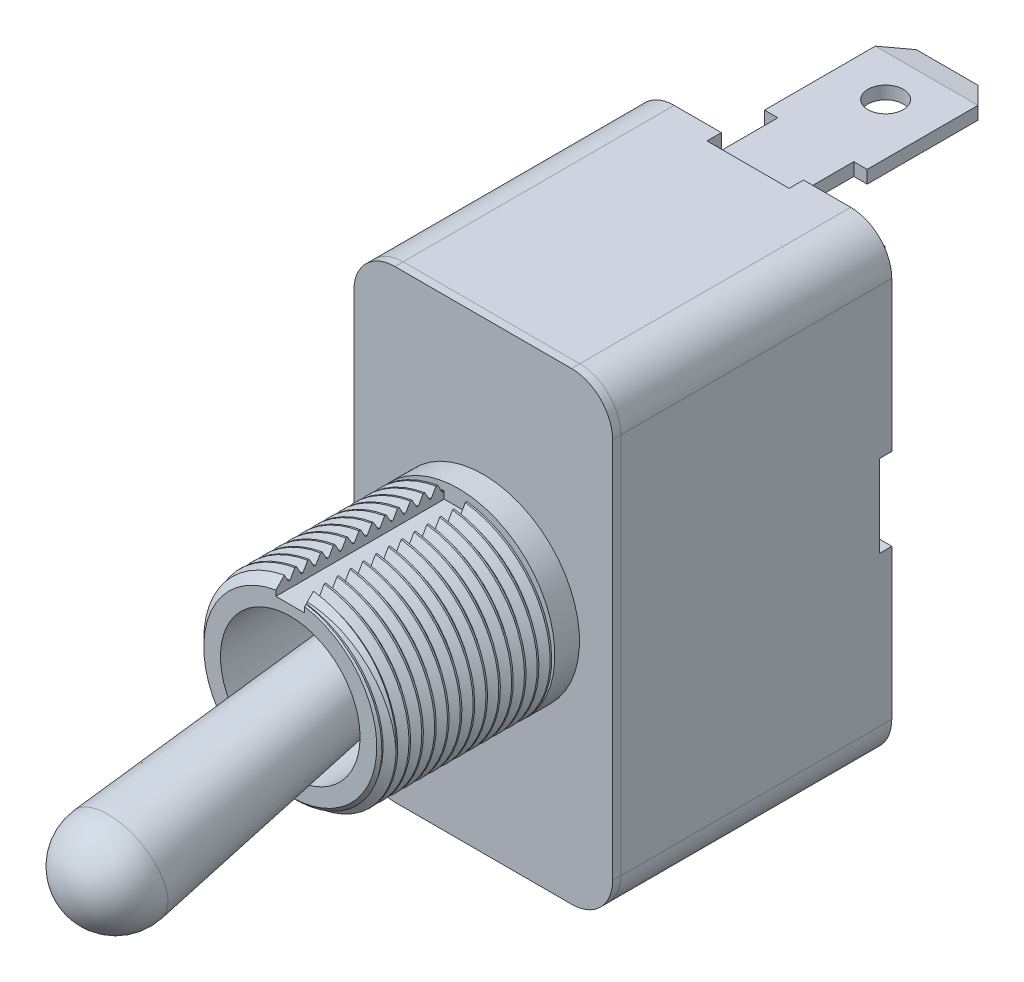
from build123d import *
from OCP.BRepFilletAPI import BRepFilletAPI_MakeChamfer

# Parameters (mm, degrees)
SKETCH4_R             = 5.953125
BOSS_EXTRUDE1_DEPTH   = 10.414
CUT_SWEEP1_PITCH      = 0.79375
SKETCH7_OUTSIDE_W     = 38.694
SKETCH7_OUTSIDE_H     = 38.694
SKETCH7_OUTSIDE_R     = 5.351643294
CUT_EXTRUDE1_DEPTH    = 10.414
CUT_EXTRUDE1_DRAFT    = -45
SKETCH8_R             = 5.953125
BOSS_EXTRUDE2_DEPTH   = 1.524
BOSS_EXTRUDE3_DEPTH   = 0.508
SKETCH10_R            = 4.318
CUT_EXTRUDE2_DEPTH    = 11.938
CUT_EXTRUDE3_DEPTH    = 10.414
BOSS_EXTRUDE4_DEPTH   = 16.764
SKETCH14_W            = 8.382
SKETCH14_H            = 5.08
CUT_EXTRUDE4_DEPTH    = 0.889
SKETCH15_W            = 5.08
SKETCH15_H            = 16.002
CUT_EXTRUDE5_DEPTH    = 0.762
SKETCH16_W            = 6.35
SKETCH16_H            = 4.699
BOSS_EXTRUDE5_DEPTH   = 0.79375
SKETCH17_R            = 1.0922
BOSS_EXTRUDE6_DEPTH   = 0.79375
CHAMFER1_SIZE         = 1.27
CHAMFER2_SIZE         = 1.27
CHAMFER2_SIZE2        = 0.1905
SKETCH18_W            = 4.699
SKETCH18_H            = 6.35
BOSS_EXTRUDE7_DEPTH   = 0.79375
SKETCH19_R            = 1.0922
BOSS_EXTRUDE8_DEPTH   = 0.79375
CHAMFER3_SIZE         = 1.27
CHAMFER4_SIZE         = 0.1905
CHAMFER4_SIZE2        = 1.27
BOSS_EXTRUDE9_START   = -6.35
SKETCH20_R            = 5.437569252
BOSS_EXTRUDE9_DEPTH   = 2.032
BODY_MOVE_COPY1_ANGLE = 120
BODY_MOVE_COPY2_ANGLE = 11.5


with BuildPart() as part:
    # Sketch4 → Boss-Extrude1 (new body)
    with BuildSketch(Plane(origin=(0, 11.938, 0), x_dir=(-1, 0, 0), z_dir=(0, 1, 0))):
        with Locations(Location((0, 0, 0), (0, 0, 90))):
            Circle(SKETCH4_R)
    extrude(amount=-BOSS_EXTRUDE1_DEPTH)

    # Cut-Sweep1: arcs per turn and ends read off the stored shape
    # Cut-Sweep1: the profile of Sketch6 screwed along a right-hand helix through 15.12 turns, 8 arcs to a turn; built about Z, then put on its axis
    cut_sweep1_z = Axis((0, 0, 0), (0, 0, 1))
    cut_sweep1_corners = [(5.437569252, 0, -1.190625), (5.437569252, 0, -1.09140625), (5.996087979, 0, -0.768945313), (5.996087979, 0, -1.513085938)]
    with BuildLine(mode=Mode.PRIVATE) as cut_sweep1_profile:
        Line(cut_sweep1_corners[0], cut_sweep1_corners[1])
        Line(cut_sweep1_corners[1], cut_sweep1_corners[2])
        Line(cut_sweep1_corners[2], cut_sweep1_corners[3])
        Line(cut_sweep1_corners[3], cut_sweep1_corners[0])
    cut_sweep1_cap = Face(cut_sweep1_profile.wire())
    cut_sweep1_turn_angles = [0, 22.5, 45, 67.5, 90, 112.5, 135, 157.5, 180, 202.5, 225, 247.5, 270, 292.5, 315, 337.5, 360]
    cut_sweep1_turn_weights = [1, 0.9238795325112867, 1, 0.9238795325112867, 1, 0.9238795325112867, 1, 0.9238795325112867, 1, 0.9238795325112867, 1, 0.9238795325112867, 1, 0.9238795325112867, 1, 0.9238795325112867, 1]
    cut_sweep1_turn_rails = [Edge.make_bspline([Vector(p[0], p[1], 0).rotate(cut_sweep1_z, cut_sweep1_turn_angles[k]) / cut_sweep1_turn_weights[k] + Vector(0, 0, p[2] + CUT_SWEEP1_PITCH * cut_sweep1_turn_angles[k] / 360) for k in range(17)], [0, 0, 0, 1, 1, 2, 2, 3, 3, 4, 4, 5, 5, 6, 6, 7, 7, 8, 8, 8], 2, cut_sweep1_turn_weights) for p in cut_sweep1_corners]
    cut_sweep1_turn_sides = [Face.make_surface_from_curves(cut_sweep1_turn_rails[p[0]], cut_sweep1_turn_rails[p[1]]) for p in [(0, 1), (1, 2), (2, 3), (3, 0)]]
    cut_sweep1_last_angles = [5400, 5421.6, 5443.2]
    cut_sweep1_last_weights = [1, 0.929776485888252, 1]
    cut_sweep1_last_rails = [Edge.make_bspline([Vector(p[0], p[1], 0).rotate(cut_sweep1_z, cut_sweep1_last_angles[k]) / cut_sweep1_last_weights[k] + Vector(0, 0, p[2] + CUT_SWEEP1_PITCH * cut_sweep1_last_angles[k] / 360) for k in range(3)], [0, 0, 0, 1, 1, 1], 2, cut_sweep1_last_weights) for p in cut_sweep1_corners]
    cut_sweep1_last_sides = [Face.make_surface_from_curves(cut_sweep1_last_rails[p[0]], cut_sweep1_last_rails[p[1]]) for p in [(0, 1), (1, 2), (2, 3), (3, 0)]]
    cut_sweep1 = Plane(origin=(0, 11.938, 0), x_dir=(-1, 0, 0), z_dir=(0, -1, 0)) * Solid(Shell([*[p.moved(Location((0, 0, CUT_SWEEP1_PITCH * i))) for i in range(15) for p in cut_sweep1_turn_sides], *cut_sweep1_last_sides, cut_sweep1_cap, cut_sweep1_cap.rotate(cut_sweep1_z, 5443.2).moved(Location((0, 0, CUT_SWEEP1_PITCH * 5443.2 / 360)))]))
    add(cut_sweep1, mode=Mode.SUBTRACT)


with BuildPart() as cut_extrude1_tool:
    # Sketch7 outside → Cut-Extrude1 (with draft: the straight prism first)
    with BuildSketch(Plane(origin=(0, 11.938, 0), x_dir=(1, 0, 0), z_dir=(0, 1, 0))):
        Rectangle(SKETCH7_OUTSIDE_W, SKETCH7_OUTSIDE_H)
        Circle(SKETCH7_OUTSIDE_R, mode=Mode.SUBTRACT)
    extrude(amount=-CUT_EXTRUDE1_DEPTH)
    # Cut-Extrude1: the draft: its side faces are tilted about the plane it starts from
    cut_extrude1_sides = [cut_extrude1_tool.faces().sort_by_distance(p)[0] for p in [
        (0, 6.731, 19.347),
        (19.347, 6.731, 0),
        (0, 6.731, -19.347),
        (-19.347, 6.731, 0),
        (-5.351643294, 6.731, 0),
    ]]
    draft(cut_extrude1_sides, Plane(origin=(0, 11.938, 0), x_dir=(1, 0, 0), z_dir=(0, 1, 0)), CUT_EXTRUDE1_DRAFT)


with BuildPart() as part_1:
    add(part.part)

    # Cut-Extrude1: cut by cut_extrude1_tool
    add(cut_extrude1_tool.part, mode=Mode.SUBTRACT)

    # Sketch8 → Boss-Extrude2 (add)
    with BuildSketch(Plane.XZ.offset(-1.524)):
        with Locations(Location((0, 0, 0), (0, 0, 92.921710335))):
            Circle(SKETCH8_R)
    extrude(amount=BOSS_EXTRUDE2_DEPTH)

    # Sketch9 → Boss-Extrude3 (add)
    with BuildSketch(Plane.XZ):
        with BuildLine():
            Line((11.811, 8.001), (-11.811, 8.001))
            ThreePointArc((-11.811, 8.001), (-13.607051224, 7.257051224), (-14.351, 5.461))
            Line((-14.351, 5.461), (-14.351, -5.461))
            ThreePointArc((-14.351, -5.461), (-13.607051224, -7.257051224), (-11.811, -8.001))
            Line((-11.811, -8.001), (11.811, -8.001))
            ThreePointArc((11.811, -8.001), (13.607051224, -7.257051224), (14.351, -5.461))
            Line((14.351, -5.461), (14.351, 5.461))
            ThreePointArc((14.351, 5.461), (13.607051224, 7.257051224), (11.811, 8.001))
        make_face()
    extrude(amount=BOSS_EXTRUDE3_DEPTH)

    # Sketch10 → Cut-Extrude2 (cut)
    with BuildSketch(Plane(origin=(0, 11.938, 0), x_dir=(1, 0, 0), z_dir=(0, 1, 0))):
        with Locations(Location((0, 0, 0), (0, 0, 270))):
            Circle(SKETCH10_R)
    extrude(amount=-CUT_EXTRUDE2_DEPTH, mode=Mode.SUBTRACT)

    # Sketch11 → Cut-Extrude3 (cut)
    with BuildSketch(Plane(origin=(0, 11.938, 0), x_dir=(1, 0, 0), z_dir=(0, 1, 0))):
        with BuildLine():
            Line((4.937125, 0.889), (4.937125, -0.889))
            Line((4.937125, -0.889), (5.88637208, -0.889))
            ThreePointArc((5.88637208, -0.889), (5.953125, 0), (5.88637208, 0.889))
            Line((5.88637208, 0.889), (4.937125, 0.889))
        make_face()
    extrude(amount=-CUT_EXTRUDE3_DEPTH, mode=Mode.SUBTRACT)


with BuildPart() as body_2:
    # Sketch12 → Revolve1 (revolve)
    with BuildSketch(Plane.XY, mode=Mode.PRIVATE) as revolve1_sk:
        with BuildLine():
            Line((0, 4.826), (-2.214699358, 4.826))
            Line((-2.214699358, 4.826), (-3.044816605, 22.974731047))
            ThreePointArc((-3.044816605, 22.974731047), (-2.203950518, 25.219446773), (0, 26.162))
            Line((0, 26.162), (0, 4.826))
        make_face()
    revolve(revolve1_sk.sketch.rotate(Axis((0, 0, 0), (0, 1, 0)), 270), axis=Axis((0, 0, 0), (0, 1, 0)))


with BuildPart() as body_3:
    # Sketch13 → Boss-Extrude4 (new body)
    with BuildSketch(Plane.XZ.offset(0.508)):
        with BuildLine():
            Line((11.811, 8.001), (-11.811, 8.001))
            ThreePointArc((-11.811, 8.001), (-13.607051224, 7.257051224), (-14.351, 5.461))
            Line((-14.351, 5.461), (-14.351, -5.461))
            ThreePointArc((-14.351, -5.461), (-13.607051224, -7.257051224), (-11.811, -8.001))
            Line((-11.811, -8.001), (11.811, -8.001))
            ThreePointArc((11.811, -8.001), (13.607051224, -7.257051224), (14.351, -5.461))
            Line((14.351, -5.461), (14.351, 5.461))
            ThreePointArc((14.351, 5.461), (13.607051224, 7.257051224), (11.811, 8.001))
        make_face()
    extrude(amount=BOSS_EXTRUDE4_DEPTH)

    # Sketch14 → Cut-Extrude4 (cut)
    with BuildSketch(Plane.XZ.offset(17.272)):
        with Locations((-10.16, 0)):
            Rectangle(SKETCH14_W, SKETCH14_H)
        with Locations((10.16, 0)):
            Rectangle(SKETCH14_W, SKETCH14_H)
    extrude(amount=-CUT_EXTRUDE4_DEPTH, mode=Mode.SUBTRACT)

    # Sketch15 → Cut-Extrude5 (cut)
    with BuildSketch(Plane.XZ.offset(17.272)):
        Rectangle(SKETCH15_W, SKETCH15_H)
    extrude(amount=-CUT_EXTRUDE5_DEPTH, mode=Mode.SUBTRACT)


with BuildPart() as body_4:
    # Sketch16 → Boss-Extrude5 (new body)
    with BuildSketch(Plane.XZ.offset(16.383)):
        with Locations((10.414, 0)):
            Rectangle(SKETCH16_W, SKETCH16_H)
    extrude(amount=BOSS_EXTRUDE5_DEPTH)

    # Sketch17 → Boss-Extrude6 (add)
    with BuildSketch(Plane.ZY.offset(-13.589)):
        Polygon((-3.175, -28.702), (3.175, -28.702), (3.175, -20.574), (2.3495, -20.574), (2.3495, -16.383), (-2.3495, -16.383), (-2.3495, -20.574), (-3.175, -20.574), align=None)
        with Locations((0, -24.892)):
            Circle(SKETCH17_R, mode=Mode.SUBTRACT)
    extrude(amount=BOSS_EXTRUDE6_DEPTH)

    # Chamfer1
    chamfer1_edges = [body_4.edges().sort_by_distance(p)[0] for p in [
        (13.192125, -28.702, -3.175),
        (13.192125, -28.702, 3.175),
    ]]
    chamfer(chamfer1_edges, length=CHAMFER1_SIZE)

    # Chamfer2: one chamfer whose edges measure the first distance from different faces: ONE call of the kernel's chamfer builder (chamfer() names one face for all edges)
    chamfer2_edges_1 = [body_4.edges().sort_by_distance(p)[0] for p in [
        (13.589, -28.702, 0),
    ]]
    chamfer2_side_1 = [body_4.faces().sort_by_distance(p)[0] for p in [
        (13.589, -22.695100049, 0),
    ]]
    chamfer2_edges_2 = [body_4.edges().sort_by_distance(p)[0] for p in [
        (12.79525, -28.702, 0),
    ]]
    chamfer2_side_2 = [body_4.faces().sort_by_distance(p)[0] for p in [
        (12.79525, -23.04971626, 0),
    ]]
    chamfer2 = BRepFilletAPI_MakeChamfer(body_4.part.solid().wrapped)
    for e in chamfer2_edges_1:
        chamfer2.Add(CHAMFER2_SIZE, CHAMFER2_SIZE2, e.wrapped, chamfer2_side_1[0].wrapped)  # the first distance lies on this face
    for e in chamfer2_edges_2:
        chamfer2.Add(CHAMFER2_SIZE, CHAMFER2_SIZE2, e.wrapped, chamfer2_side_2[0].wrapped)  # the first distance lies on this face
    add(Compound.cast(chamfer2.Shape()), mode=Mode.REPLACE)


with BuildPart() as body_5:
    # Sketch18 → Boss-Extrude7 (new body)
    with BuildSketch(Plane.XZ.offset(16.51)):
        with Locations((0, -1.27)):
            Rectangle(SKETCH18_W, SKETCH18_H)
    extrude(amount=BOSS_EXTRUDE7_DEPTH)

    # Sketch19 → Boss-Extrude8 (add)
    with BuildSketch(Plane.XY.offset(-4.445)):
        Polygon((3.175, -28.702), (-3.175, -28.702), (-3.175, -20.574), (-2.3495, -20.574), (-2.3495, -16.51), (2.3495, -16.51), (2.3495, -20.574), (3.175, -20.574), align=None)
        with Locations((0, -24.892)):
            Circle(SKETCH19_R, mode=Mode.SUBTRACT)
    extrude(amount=BOSS_EXTRUDE8_DEPTH)

    # Chamfer3
    chamfer3_edges = [body_5.edges().sort_by_distance(p)[0] for p in [
        (-3.175, -28.702, -4.048125),
        (3.175, -28.702, -4.048125),
    ]]
    chamfer(chamfer3_edges, length=CHAMFER3_SIZE)

    # Chamfer4
    chamfer4_edges = [body_5.edges().sort_by_distance(p)[0] for p in [
        (0, -28.702, -3.65125),
        (0, -28.702, -4.445),
    ]]
    chamfer4_side = [body_5.faces().sort_by_distance(p)[0] for p in [
        (0, -28.702, -4.048125),
    ]]
    chamfer(chamfer4_edges, length=CHAMFER4_SIZE, length2=CHAMFER4_SIZE2, reference=chamfer4_side[0])


with BuildPart() as body_6:
    # Sketch20 → Boss-Extrude9 (new body)
    with BuildSketch(Plane(origin=(0, 11.938, 0), x_dir=(1, 0, 0), z_dir=(0, 1, 0)).offset(BOSS_EXTRUDE9_START)):
        Polygon((4.619379504, 8.001), (-4.619379504, 8.001), (-9.238759008, 0), (-4.619379504, -8.001), (4.619379504, -8.001), (9.238759008, 0), align=None)
        with Locations(Location((0, 0, 0), (0, 0, 270))):
            Circle(SKETCH20_R, mode=Mode.SUBTRACT)
    extrude(amount=BOSS_EXTRUDE9_DEPTH)

    # Sketch21 → Cut-Revolve1 (revolve, cut)
    with BuildSketch(Plane.XY, mode=Mode.PRIVATE) as cut_revolve1_sk:
        Polygon((-5.437569252, 7.62), (-5.437569252, 7.018518294), (-6.039050958, 7.62), align=None)
        Polygon((-9.238759008, 7.62), (-8.001, 7.62), (-9.238759008, 6.905379504), align=None)
        Polygon((-5.437569252, 6.189481706), (-5.437569252, 5.588), (-6.039050958, 5.588), align=None)
        Polygon((-9.238759008, 5.588), (-9.238759008, 6.302620496), (-8.001, 5.588), align=None)
    revolve(cut_revolve1_sk.sketch.rotate(Axis((0, 7.62, 0), (0, -1, 0)), 270), axis=Axis((0, 7.62, 0), (0, -1, 0)), mode=Mode.SUBTRACT)


with BuildPart() as part_2:
    # Body-Move/Copy1: moved
    add(part_1.part.moved(Location((0, 0, 0))).rotate(Axis((2.677958583, -3.408583833, 0.73062525), (0.5773502691896252, 0.5773502691896272, 0.5773502691896252)), BODY_MOVE_COPY1_ANGLE))


with BuildPart() as body_2_1:
    # Body-Move/Copy1: moved
    add(body_2.part.moved(Location((0, 0, 0))).rotate(Axis((2.677958583, -3.408583833, 0.73062525), (0.5773502691896252, 0.5773502691896272, 0.5773502691896252)), BODY_MOVE_COPY1_ANGLE))


with BuildPart() as body_3_1:
    # Body-Move/Copy1: moved
    add(body_3.part.moved(Location((0, 0, 0))).rotate(Axis((2.677958583, -3.408583833, 0.73062525), (0.5773502691896252, 0.5773502691896272, 0.5773502691896252)), BODY_MOVE_COPY1_ANGLE))


with BuildPart() as body_4_1:
    # Body-Move/Copy1: moved
    add(body_4.part.moved(Location((0, 0, 0))).rotate(Axis((2.677958583, -3.408583833, 0.73062525), (0.5773502691896252, 0.5773502691896272, 0.5773502691896252)), BODY_MOVE_COPY1_ANGLE))


with BuildPart() as body_5_1:
    # Body-Move/Copy1: moved
    add(body_5.part.moved(Location((0, 0, 0))).rotate(Axis((2.677958583, -3.408583833, 0.73062525), (0.5773502691896252, 0.5773502691896272, 0.5773502691896252)), BODY_MOVE_COPY1_ANGLE))


with BuildPart() as body_6_1:
    # Body-Move/Copy1: moved
    add(body_6.part.moved(Location((0, 0, 0))).rotate(Axis((2.677958583, -3.408583833, 0.73062525), (0.5773502691896252, 0.5773502691896272, 0.5773502691896252)), BODY_MOVE_COPY1_ANGLE))


with BuildPart() as body_2_2:
    # Body-Move/Copy2: moved
    add(body_2_1.part.rotate(Axis((0, -6.086542415, 8.831753599), (1, 0, 0)), BODY_MOVE_COPY2_ANGLE))


solid = Compound([part_2.part, body_3_1.part, body_4_1.part, body_5_1.part, body_2_2.part])
